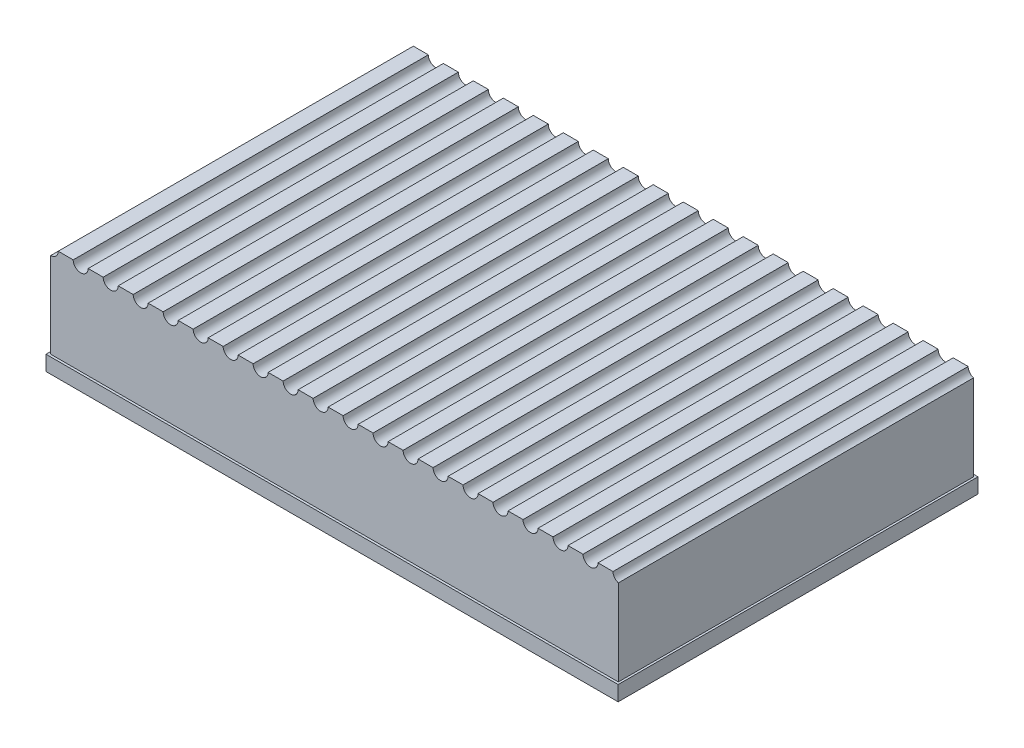
from build123d import *

# Parameters (mm, degrees)
SKETCH1_W           = 121.1453
SKETCH1_H           = 76.2
BOSS_EXTRUDE1_DEPTH = 3.175
BOSS_EXTRUDE4_DEPTH = 19.685
SKETCH4_R           = 1.5875
CUT_EXTRUDE1_DEPTH  = 145.669462265


with BuildPart() as part:
    # Sketch1 → Boss-Extrude1 (new body)
    with BuildSketch(Plane(origin=(0, 0, 0), x_dir=(1, 0, 0), z_dir=(0, 1, 0))):
        with Locations((-60.57265, 38.1)):
            Rectangle(SKETCH1_W, SKETCH1_H)
    extrude(amount=BOSS_EXTRUDE1_DEPTH)

    # Sketch3 → Boss-Extrude4 (add)
    with BuildSketch(Plane(origin=(0, 3.175, 0), x_dir=(1, 0, 0), z_dir=(0, 1, 0))):
        Polygon((-0.455093751, 75.7), (-120.65, 75.7), (-120.65, 0.5), (-0.455093751, 0.5), (-0.455093751, 14.034671148), align=None)
    extrude(amount=BOSS_EXTRUDE4_DEPTH)

    # Sketch4 → Cut-Extrude1 (cut, through all)
    with BuildSketch(Plane.XY.offset(-0.5)):
        with Locations((-120.65, 22.86)):
            Circle(SKETCH4_R)
        with Locations((-114.3, 22.86)):
            Circle(SKETCH4_R)
        with Locations((-107.95, 22.86)):
            Circle(SKETCH4_R)
        with Locations((-101.6, 22.86)):
            Circle(SKETCH4_R)
        with Locations((-95.25, 22.86)):
            Circle(SKETCH4_R)
        with Locations((-88.9, 22.86)):
            Circle(SKETCH4_R)
        with Locations((-82.55, 22.86)):
            Circle(SKETCH4_R)
        with Locations((-76.2, 22.86)):
            Circle(SKETCH4_R)
        with Locations((-69.85, 22.86)):
            Circle(SKETCH4_R)
        with Locations((-63.5, 22.86)):
            Circle(SKETCH4_R)
        with Locations((-57.15, 22.86)):
            Circle(SKETCH4_R)
        with Locations((-50.8, 22.86)):
            Circle(SKETCH4_R)
        with Locations((-44.45, 22.86)):
            Circle(SKETCH4_R)
        with Locations((-38.1, 22.86)):
            Circle(SKETCH4_R)
        with Locations((-31.75, 22.86)):
            Circle(SKETCH4_R)
        with Locations((-25.4, 22.86)):
            Circle(SKETCH4_R)
        with Locations((-19.05, 22.86)):
            Circle(SKETCH4_R)
        with Locations((-12.7, 22.86)):
            Circle(SKETCH4_R)
        with Locations((-6.35, 22.86)):
            Circle(SKETCH4_R)
        with Locations((0, 22.86)):
            Circle(SKETCH4_R)
        with Locations((6.35, 22.86)):
            Circle(SKETCH4_R)
    extrude(amount=-CUT_EXTRUDE1_DEPTH, mode=Mode.SUBTRACT)


solid = part.part
